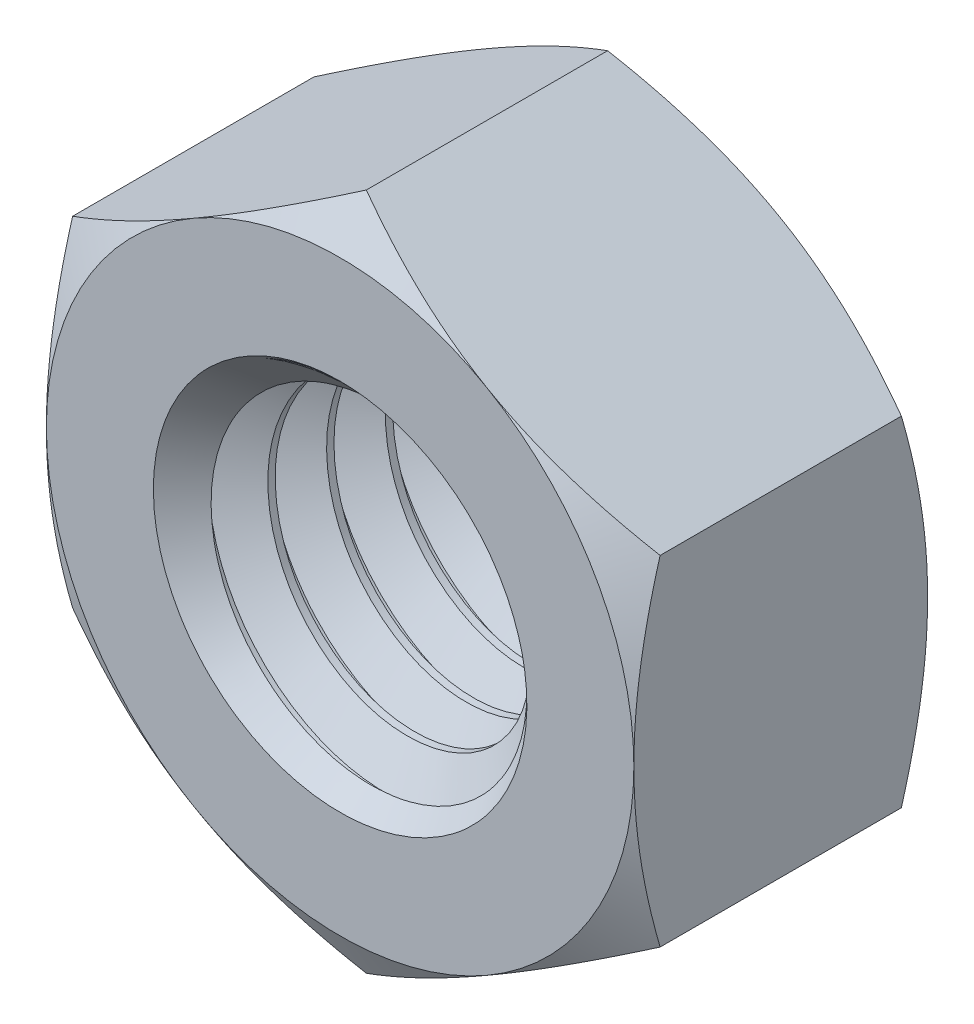
from build123d import *

# Parameters (mm, degrees)
BOSS_EXTRUDE1_DEPTH      = 2
BOSS_EXTRUDE1_DEPTH_BACK = 2
SKETCH2_R                = 2.5
SKETCH3_OUTSIDE_W        = 41.334
SKETCH3_OUTSIDE_H        = 42.572
SKETCH3_OUTSIDE_R        = 4
CUT_EXTRUDE1_DEPTH       = 8.302967433
CUT_EXTRUDE1_DRAFT       = -60
MIRROR1_COPY_1_SKETCH_W  = 41.334
MIRROR1_COPY_1_SKETCH_H  = 42.572
MIRROR1_COPY_1_SKETCH_R  = 4
MIRROR1_COPY_1_DEPTH     = 8.302967433
MIRROR1_COPY_1_DRAFT     = -60
SWEEP1_PITCH             = 0.8
SKETCH7_R                = 2.54330127
CUT_EXTRUDE3_DEPTH       = 8.302968661


with BuildPart() as part:
    # Sketch2 → Boss-Extrude1 (new, two sides: drawn at the far end of the back side and taken through both)
    with BuildSketch(Plane.XY.offset(-BOSS_EXTRUDE1_DEPTH_BACK)):
        Polygon((0, 4.618802154), (-4, 2.309401077), (-4, -2.309401077), (0, -4.618802154), (4, -2.309401077), (4, 2.309401077), align=None)
        Circle(SKETCH2_R, mode=Mode.SUBTRACT)
    extrude(amount=BOSS_EXTRUDE1_DEPTH + BOSS_EXTRUDE1_DEPTH_BACK)


with BuildPart() as cut_extrude1_tool:
    # Sketch3 outside → Cut-Extrude1 (with draft: the straight prism first)
    with BuildSketch(Plane.XY.offset(2)):
        Rectangle(SKETCH3_OUTSIDE_W, SKETCH3_OUTSIDE_H)
        Circle(SKETCH3_OUTSIDE_R, mode=Mode.SUBTRACT)
    extrude(amount=-CUT_EXTRUDE1_DEPTH)
    # Cut-Extrude1: the draft: its side faces are tilted about the plane it starts from
    cut_extrude1_sides = [cut_extrude1_tool.faces().sort_by_distance(p)[0] for p in [
        (0, -21.286, -2.151483717),
        (20.667, 0, -2.151483717),
        (0, 21.286, -2.151483717),
        (-20.667, 0, -2.151483717),
        (-4, 0, -2.151483717),
    ]]
    draft(cut_extrude1_sides, Plane.XY.offset(2), CUT_EXTRUDE1_DRAFT)


with BuildPart() as part_1:
    add(part.part)

    # Cut-Extrude1: cut by cut_extrude1_tool
    add(cut_extrude1_tool.part, mode=Mode.SUBTRACT)


with BuildPart() as mirror1_copy_1_tool:
    # Mirror1 copy 1 sketch → Mirror1 copy 1 (with draft: the straight prism first)
    with BuildSketch(Plane(origin=(0, 0, -2), x_dir=(1, 0, 0), z_dir=(0, 0, -1))):
        Rectangle(MIRROR1_COPY_1_SKETCH_W, MIRROR1_COPY_1_SKETCH_H)
        Circle(MIRROR1_COPY_1_SKETCH_R, mode=Mode.SUBTRACT)
    extrude(amount=-MIRROR1_COPY_1_DEPTH)
    # Mirror1 copy 1: the draft: its side faces are tilted about the plane it starts from
    mirror1_copy_1_sides = [mirror1_copy_1_tool.faces().sort_by_distance(p)[0] for p in [
        (0, -21.286, 2.151483717),
        (20.667, 0, 2.151483717),
        (0, 21.286, 2.151483717),
        (-20.667, 0, 2.151483717),
        (-4, 0, 2.151483717),
    ]]
    draft(mirror1_copy_1_sides, Plane(origin=(0, 0, -2), x_dir=(1, 0, 0), z_dir=(0, 0, -1)), MIRROR1_COPY_1_DRAFT)


with BuildPart() as part_2:
    add(part_1.part)

    # Mirror1 copy 1: cut by mirror1_copy_1_tool
    add(mirror1_copy_1_tool.part, mode=Mode.SUBTRACT)

    # Sweep1: arcs per turn and ends read off the stored shape
    # Sweep1: the profile of Sketch4 screwed along a right-hand helix through 6 turns, 8 arcs to a turn; built about Z, then put on its axis
    sweep1_z = Axis((0, 0, 0), (0, 0, 1))
    sweep1_corners = [(2.54330127, 0, -0.725), (1.980384758, 0, -0.4), (1.980384758, 0, -0.3), (2.54330127, 0, 0.025)]
    with BuildLine(mode=Mode.PRIVATE) as sweep1_profile:
        Line(sweep1_corners[0], sweep1_corners[1])
        Line(sweep1_corners[1], sweep1_corners[2])
        Line(sweep1_corners[2], sweep1_corners[3])
        Line(sweep1_corners[3], sweep1_corners[0])
    sweep1_cap = Face(sweep1_profile.wire())
    sweep1_turn_angles = [0, 22.5, 45, 67.5, 90, 112.5, 135, 157.5, 180, 202.5, 225, 247.5, 270, 292.5, 315, 337.5, 360]
    sweep1_turn_weights = [1, 0.9238795325112867, 1, 0.9238795325112867, 1, 0.9238795325112867, 1, 0.9238795325112867, 1, 0.9238795325112867, 1, 0.9238795325112867, 1, 0.9238795325112867, 1, 0.9238795325112867, 1]
    sweep1_turn_rails = [Edge.make_bspline([Vector(p[0], p[1], 0).rotate(sweep1_z, sweep1_turn_angles[k]) / sweep1_turn_weights[k] + Vector(0, 0, p[2] + SWEEP1_PITCH * sweep1_turn_angles[k] / 360) for k in range(17)], [0, 0, 0, 1, 1, 2, 2, 3, 3, 4, 4, 5, 5, 6, 6, 7, 7, 8, 8, 8], 2, sweep1_turn_weights) for p in sweep1_corners]
    sweep1_turn_sides = [Face.make_surface_from_curves(sweep1_turn_rails[p[0]], sweep1_turn_rails[p[1]]) for p in [(0, 1), (1, 2), (2, 3), (3, 0)]]
    sweep1 = Plane(origin=(0, 0, 2), x_dir=(0, 1, 0), z_dir=(0, 0, -1)) * Solid(Shell([*[p.moved(Location((0, 0, SWEEP1_PITCH * i))) for i in range(6) for p in sweep1_turn_sides], sweep1_cap, sweep1_cap.rotate(sweep1_z, 2160).moved(Location((0, 0, SWEEP1_PITCH * 2160 / 360)))]))
    add(sweep1)

    # Cut-Extrude2: read off the stored shape, not the designer's step
    # Cut-Extrude2 outline → Cut-Extrude2 (revolve, cut)
    with BuildSketch(Plane.XZ):
        Polygon((1.980380661, 1.437079391), (2.543303313, 2.000002042), (2.543303313, 2.7250001), (1.980380661, 2.7250001), align=None)
    revolve(axis=Axis((0, 0, 0), (0, 0, 1)), mode=Mode.SUBTRACT)

    # Sketch7 → Cut-Extrude3 (cut)
    with BuildSketch(Plane(origin=(0, 0, -2), x_dir=(-1, 0, 0), z_dir=(0, 0, -1))):
        Circle(SKETCH7_R)
    extrude(amount=CUT_EXTRUDE3_DEPTH, mode=Mode.SUBTRACT)

    # Cut-Extrude3 cone 1 section (through the dimple's axis) → Cut-Extrude3 other way (revolve, cut)
    with BuildSketch(Plane(origin=(0, 0, -2), x_dir=(0, 1, 0), z_dir=(1, 0, 0))):
        Polygon((0, 0), (2.54330127, 0), (0, 2.54330127), align=None)
    revolve(axis=Axis((0, 0, -2), (0, 0, 1)), mode=Mode.SUBTRACT)


solid = part_2.part
